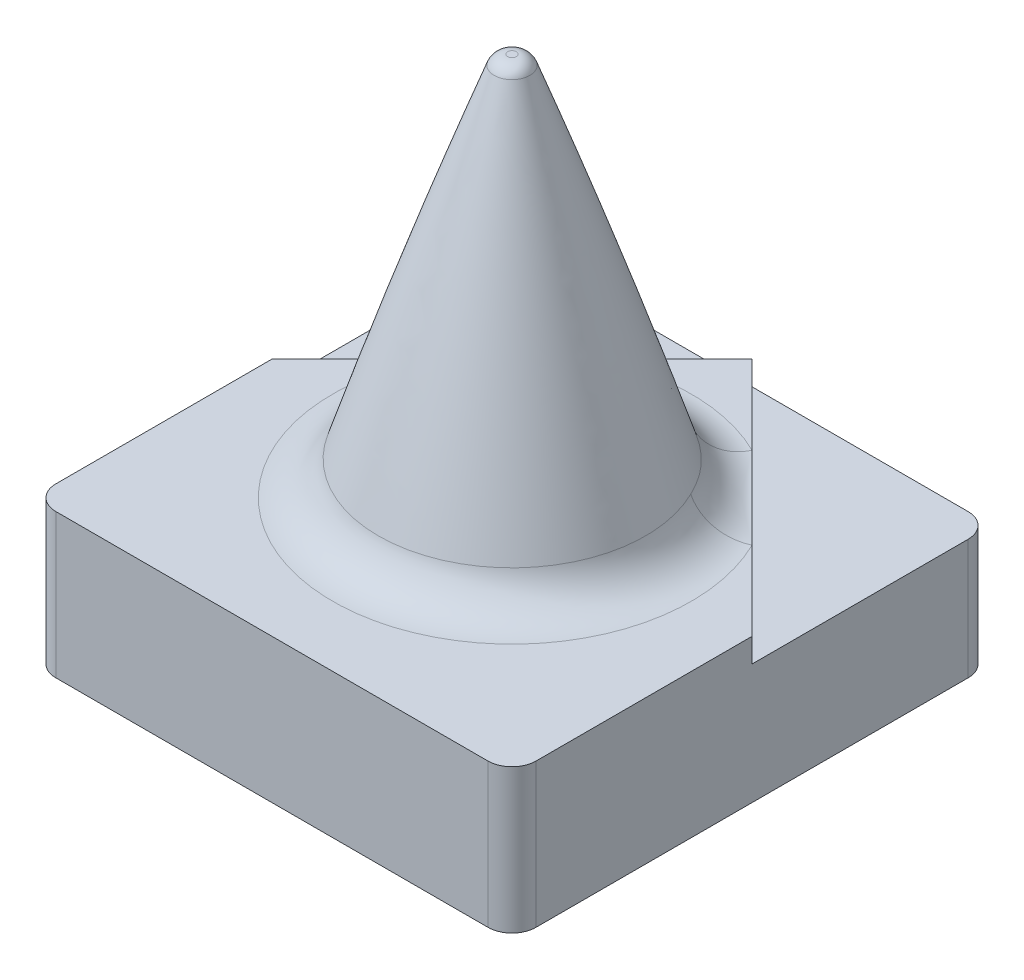
from build123d import *

# Parameters (mm, degrees)
ESQUISSE1_W             = 10
ESQUISSE1_H             = 10
BOSS_EXTRU_1_DEPTH      = 3
ENL_V_MAT_EXTRU_1_DEPTH = 0.5
CONG_2_R                = 0.3
CONG_3_R                = 0.5
CONG_4_R                = 1


with BuildPart() as part:
    # Esquisse1 → Boss.-Extru.1 (new body)
    with BuildSketch(Plane(origin=(0, 0, 0), x_dir=(1, 0, 0), z_dir=(0, 1, 0))):
        Rectangle(ESQUISSE1_W, ESQUISSE1_H)
    extrude(amount=BOSS_EXTRU_1_DEPTH)

    # Esquisse2 → Enlèv. mat.-Extru.1 (cut)
    with BuildSketch(Plane(origin=(0, 3, 0), x_dir=(1, 0, 0), z_dir=(0, 1, 0))):
        Polygon((-5, 5), (-5, 0), (0, 5), align=None)
        Polygon((5, 5), (0, 5), (5, 0), align=None)
    extrude(amount=-ENL_V_MAT_EXTRU_1_DEPTH, mode=Mode.SUBTRACT)

    # Esquisse4 → Révolution1 (revolve)
    with BuildSketch(Plane.XY):
        with BuildLine():
            Line((0, 11), (0, 3))
            Line((0, 3), (3, 3))
            add(Edge.make_bspline(
                [(3, 3), (1.757468502, 7.036344235), (0.3, 11)],
                knots=[0, 0, 0, 1, 1, 1], degree=2))
            Line((0.3, 11), (0, 11))
        make_face()
    revolve(axis=Axis((0, 11, 0), (0, -1, 0)))

    # Congé2
    cong_2_edges = [part.edges().sort_by_distance(p)[0] for p in [
        (-0.3, 11, 0),
    ]]
    fillet(cong_2_edges, radius=CONG_2_R)

    # Congé3
    cong_3_edges = [part.edges().sort_by_distance(p)[0] for p in [
        (-5, 1.25, -5),
        (5, 1.25, -5),
        (5, 1.5, 5),
        (-5, 1.5, 5),
    ]]
    fillet(cong_3_edges, radius=CONG_3_R)

    # Esquisse5 → Enlèvement de matière-Révolution1 (revolve, cut)
    with BuildSketch(Plane.XY):
        with BuildLine():
            Line((0, 8.5), (0, 0))
            Line((0, 0), (3.5, 0))
            add(Edge.make_bspline(
                [(3.5, 0), (2.691830982, 0.756326133), (2.902546059, 1.162637784), (1.281742449, 5.943314003), (0.822558462, 7.123151314), (0.4, 8.5)],
                knots=[0, 0, 0, 0, 0.197892624, 0.297892624, 1, 1, 1, 1], degree=3))
            Line((0.4, 8.5), (0, 8.5))
        make_face()
    revolve(axis=Axis((0, 8.5, 0), (0, -1, 0)), mode=Mode.SUBTRACT)

    # Congé4
    cong_4_edges = [part.edges().sort_by_distance(p)[0] for p in [
        (-3, 3, 0),
    ]]
    fillet(cong_4_edges, radius=CONG_4_R)


solid = part.part
